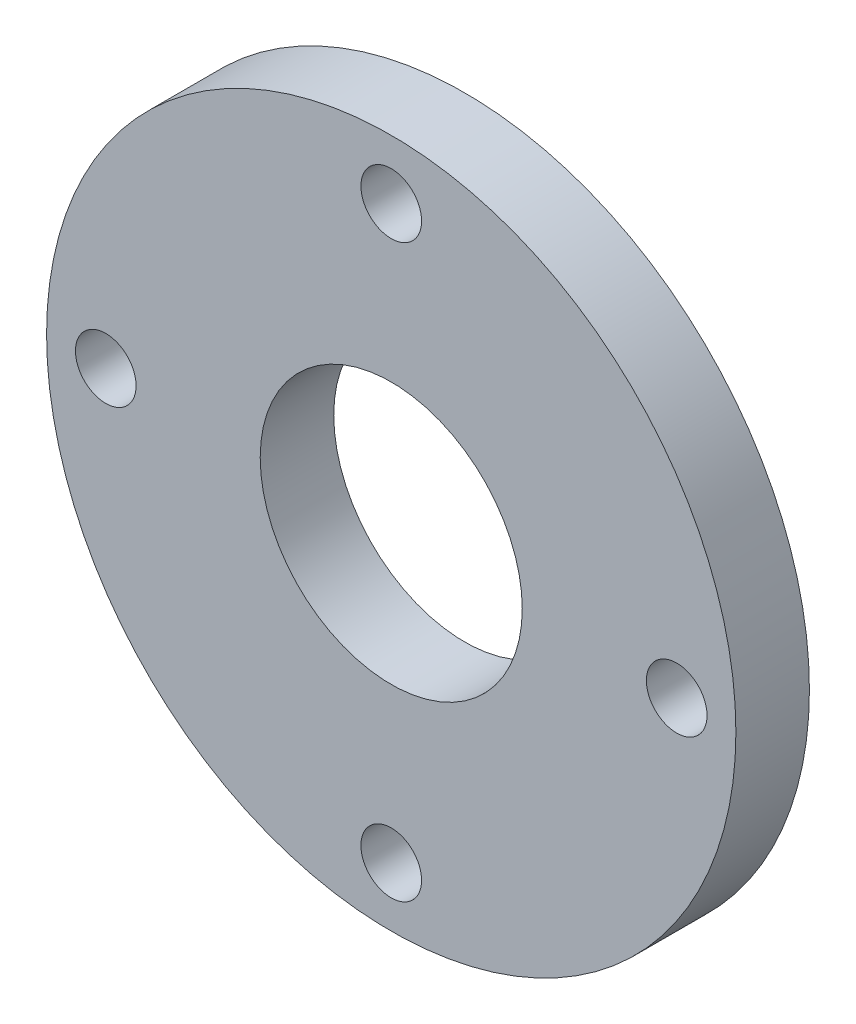
from build123d import *

# Parameters (mm, degrees)
SKETCH1_W            = 8
SKETCH1_H            = 28
SKETCH5_R            = 14.25575
SEAL_SEAT_DEPTH      = 54.633012222
M6_CLEARANCE_HOLE1_D = 6.6
CIRPATTERN1_COUNT    = 4


with BuildPart() as part:
    # Sketch1 → Main_body (revolve)
    with BuildSketch(Plane(origin=(0, 0, 0), x_dir=(0, 0, -1), z_dir=(1, 0, 0))):
        with Locations((-140.284, 23.5)):
            Rectangle(SKETCH1_W, SKETCH1_H)
    revolve(axis=Axis((0, 0, 1000), (0, 0, -1)))

    # Sketch5 → seal_seat (cut, through all)
    with BuildSketch(Plane.XY.offset(144.284)):
        Circle(SKETCH5_R)
    extrude(amount=-SEAL_SEAT_DEPTH, mode=Mode.SUBTRACT)

    # M6 Clearance Hole1 (through all)
    with Locations(Plane.XY.offset(144.284)):
        with Locations((0, 31.05935)):
            m6_clearance_hole1 = Hole(M6_CLEARANCE_HOLE1_D / 2)

    # CirPattern1: M6 Clearance Hole1 ×4 about axis
    cirpattern1_axis = Axis((0, 0, 1000), (0, 0, -1))
    for i in range(1, CIRPATTERN1_COUNT):
        add(m6_clearance_hole1.rotate(cirpattern1_axis, i * 360 / CIRPATTERN1_COUNT), mode=Mode.SUBTRACT)


solid = part.part
